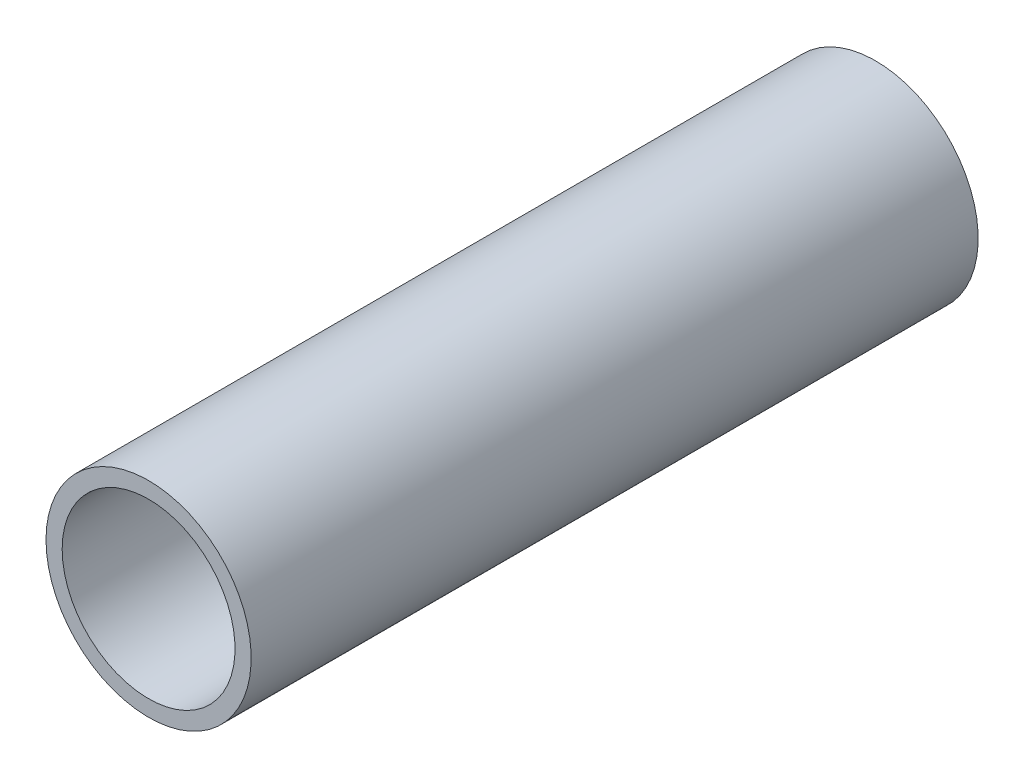
from build123d import *

# Parameters (mm, degrees)
SKETCH1_R           = 12.7
SKETCH1_R_2         = 10.7
BOSS_EXTRUDE1_DEPTH = 90


with BuildPart() as part:
    # Sketch1 → Boss-Extrude1 (new body)
    with BuildSketch(Plane.XY):
        Circle(SKETCH1_R)
        Circle(SKETCH1_R_2, mode=Mode.SUBTRACT)
    extrude(amount=BOSS_EXTRUDE1_DEPTH)


solid = part.part
